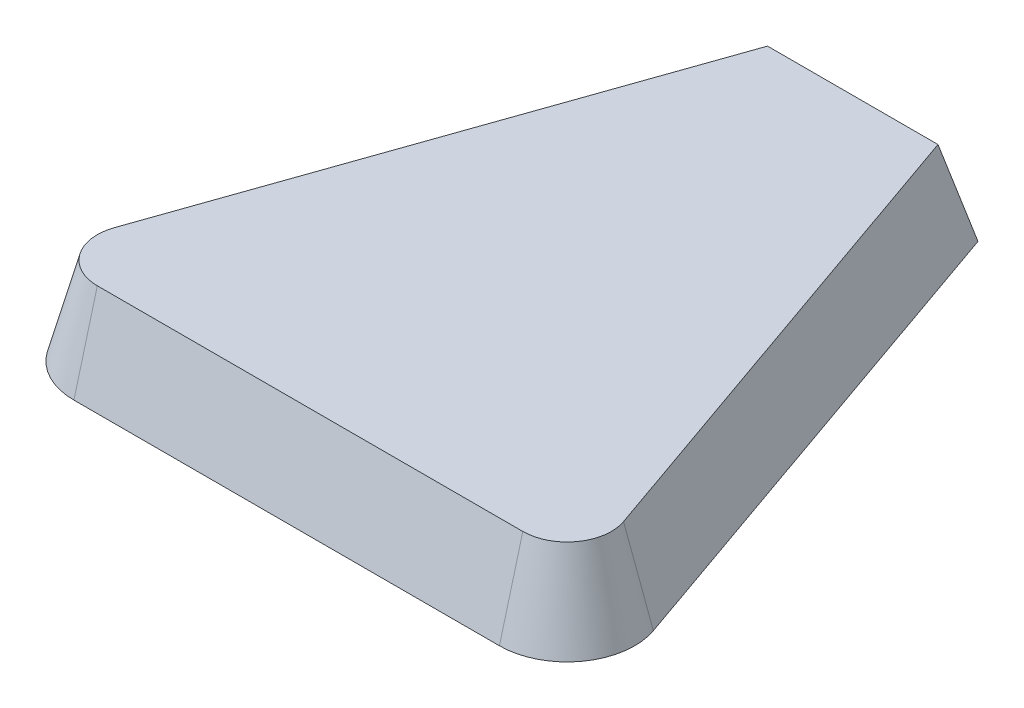
from build123d import *

# Parameters (mm, degrees)
BOSS_EXTRUDE1_DEPTH = 25
DRAFT8_ANGLE        = 15
SHELL1_T            = -5


with BuildPart() as part:
    # Sketch2 → Boss-Extrude1 (new body)
    with BuildSketch(Plane(origin=(0, 0, 0), x_dir=(1, 0, 0), z_dir=(0, 1, 0))):
        with BuildLine():
            Line((0, 0), (45, 0))
            Line((45, 0), (92.843773513, -136.696495753))
            ThreePointArc((92.843773513, -136.696495753), (91.56101739, -145.786404649), (83.40518995, -150))
            Line((83.40518995, -150), (-38.40518995, -150))
            ThreePointArc((-38.40518995, -150), (-46.56101739, -145.786404649), (-47.843773513, -136.696495753))
            Line((-47.843773513, -136.696495753), (0, 0))
        make_face()
    extrude(amount=BOSS_EXTRUDE1_DEPTH)

    # Draft8
    draft8_faces = [part.faces().sort_by_distance(p)[0] for p in [
        (22.5, 12.5, 0),
        (-46.56101739, 12.5, 145.786404649),
        (91.56101739, 12.5, 145.786404649),
        (68.921886757, 12.5, 68.348247876),
        (22.5, 12.5, 150),
        (-23.921886757, 12.5, 68.348247876),
    ]]
    draft(draft8_faces, Plane.ZX.offset(35), DRAFT8_ANGLE)

    # Shell1
    shell1_openings = [part.faces().sort_by_distance(p)[0] for p in [
        (22.5, 0, 88.026028121),
    ]]
    offset(amount=SHELL1_T, openings=shell1_openings, kind=Kind.INTERSECTION)


solid = part.part
